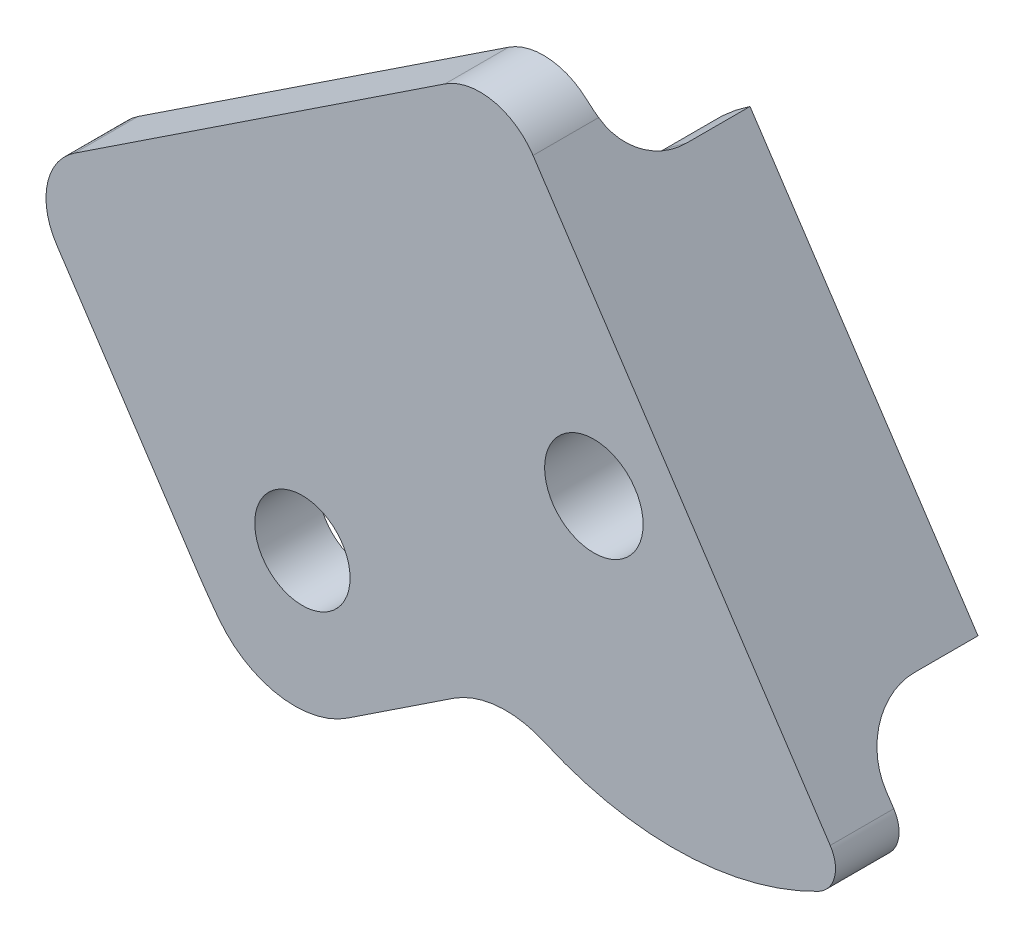
from build123d import *
from build123d.topology import SkipClean

# Parameters (mm, degrees)
EXTRUDE_1_DEPTH     = 2
EXTRUDE_START       = 4
SKETCH_3_R          = 1.55
EXTRUDE_2_DEPTH     = 4
FILLET_1_R          = 2
CUT_EXTRUDE_1_DEPTH = 10
FILLET_2_R          = 2


with BuildPart() as part:
    # 草图2 → 凸台-拉伸1 (new body)
    with BuildSketch(Plane.XY):
        with BuildLine():
            Line((14.564994601, -11.669618141), (7.389813792, -0.829102454))
            Line((7.389813792, -0.829102454), (6.837876806, 0.004783368))
            Line((6.837876806, 0.004783368), (4.07819188, 4.174212479))
            Line((4.07819188, 4.174212479), (3.526254895, 5.008098301))
            Line((3.526254895, 5.008098301), (-3.648925914, 15.848613988))
            Line((-3.648925914, 15.848613988), (-4.2008629, 16.68249981))
            Line((-4.2008629, 16.68249981), (-4.998009984, 17.886857679))
            ThreePointArc((-4.998009984, 17.886857679), (-5.687361464, 18.324420478), (-6.473069172, 18.102316754))
            ThreePointArc((-6.473069172, 18.102316754), (-9.153711125, 14.591132343), (-10.06004351, 10.267613076))
            ThreePointArc((-10.06004351, 10.267613076), (-10.405656258, 8.820717267), (-11.403844954, 7.717732689))
            Line((-11.403844954, 7.717732689), (-14.736003804, 5.512224858))
            ThreePointArc((-14.736003804, 5.512224858), (-15.998358454, 3.706490878), (-15.686779581, 1.525405581))
            ThreePointArc((-15.686779581, 1.525405581), (-15.380816242, 1.008667124), (-15.057770631, 0.502432268))
            Line((-15.057770631, 0.502432268), (-4.019030925, -16.175284173))
            ThreePointArc((-4.019030925, -16.175284173), (-3.679263259, -16.670450943), (-3.323152402, -17.153997481))
            ThreePointArc((-3.323152402, -17.153997481), (-1.437196365, -18.293025266), (0.718231785, -17.83657816))
            Line((0.718231785, -17.83657816), (4.050390635, -15.631070329))
            ThreePointArc((4.050390635, -15.631070329), (5.455716688, -15.143203199), (6.922632961, -15.390412219))
            ThreePointArc((6.922632961, -15.390412219), (11.256585707, -16.245462422), (15.536058254, -15.149847541))
            ThreePointArc((15.536058254, -15.149847541), (16.047506269, -14.513382621), (15.91407867, -13.707861832))
            Line((15.91407867, -13.707861832), (15.116931586, -12.503503963))
            Line((15.116931586, -12.503503963), (14.564994601, -11.669618141))
        make_face()
        with BuildLine():
            ThreePointArc((-1.270469952, 9.628047515), (-3.418495303, 10.065068212), (-3.855516, 7.917042861))
            ThreePointArc((-3.855516, 7.917042861), (-1.707490649, 7.480022164), (-1.270469952, 9.628047515))
        make_face(mode=Mode.SUBTRACT)
        with BuildLine():
            ThreePointArc((7.183223706, -8.76067358), (9.331249057, -9.197694277), (9.768269754, -7.049668926))
            ThreePointArc((9.768269754, -7.049668926), (7.620244403, -6.612648229), (7.183223706, -8.76067358))
        make_face(mode=Mode.SUBTRACT)
        with BuildLine():
            ThreePointArc((-1.947826046, -14.804383569), (0.130908165, -15.227306825), (0.55383142, -13.148572614))
            ThreePointArc((0.55383142, -13.148572614), (-1.524902791, -12.725649358), (-1.947826046, -14.804383569))
        make_face(mode=Mode.SUBTRACT)
        with BuildLine():
            ThreePointArc((-10.484908286, 3.529143828), (-12.563642497, 3.952067083), (-12.986565752, 1.873332872))
            ThreePointArc((-12.986565752, 1.873332872), (-10.907831541, 1.450409617), (-10.484908286, 3.529143828))
        make_face(mode=Mode.SUBTRACT)
    extrude(amount=EXTRUDE_1_DEPTH)

    # 草图3 → 凸台-拉伸2 (add)
    # profile 1 of 2: a face of its own
    with SkipClean():  # the faces are left unmerged after this step: merging them gives an invalid solid
        with BuildSketch(Plane(origin=(0, 0, 0), x_dir=(-1, 0, 0), z_dir=(0, 0, -1)).offset(EXTRUDE_START)):
            with BuildLine():
                ThreePointArc((-3.526254895, 5.008098301), (5.481593353, 6.84076574), (3.648925914, 15.848613988))
                Line((3.648925914, 15.848613988), (-3.526254895, 5.008098301))
            make_face()
            with Locations((2.562992976, 8.772545188)):
                Circle(SKETCH_3_R, mode=Mode.SUBTRACT)
        # profile 2 of 2: a face of its own
        with BuildSketch(Plane(origin=(0, 0, 0), x_dir=(-1, 0, 0), z_dir=(0, 0, -1)).offset(EXTRUDE_START)):
            with BuildLine():
                ThreePointArc((-14.564994601, -11.669618141), (-5.557146353, -9.836950702), (-7.389813792, -0.829102454))
                Line((-7.389813792, -0.829102454), (-14.564994601, -11.669618141))
            make_face()
            with Locations((-8.47574673, -7.905171253)):
                Circle(SKETCH_3_R, mode=Mode.SUBTRACT)
        extrude(amount=-EXTRUDE_2_DEPTH)

    # 圆角1
    # the kernel refuses this fillet: 2 mm, written as the material it adds along each edge
    with BuildSketch(Plane(origin=(10.977404196, -6.249360297, 0), x_dir=(0.5519369853128372, -0.8338858220666526, 0), z_dir=(0.8338858220666526, 0.5519369853128372, 0))) as fillet_1_piece_1:
        with BuildLine():
            CenterArc((6.5 + FILLET_1_R, FILLET_1_R), FILLET_1_R, 180, 90)
            Line((6.5, FILLET_1_R), (6.5, 0))
            Line((6.5, 0), (6.5 + FILLET_1_R, 0))
        make_face()
    revolve(axis=Axis((10.977404196, -6.249360297, 0), (0, 0, -1)), revolution_arc=180)
    with BuildSketch(Plane(origin=(-0.06133551, 10.428356144, 0), x_dir=(0.5519369853122391, -0.8338858220670484, 0), z_dir=(0.8338858220670484, 0.5519369853122391, 0))) as fillet_1_piece_2:
        with BuildLine():
            CenterArc((6.5 + FILLET_1_R, FILLET_1_R), FILLET_1_R, 180, 90)
            Line((6.5, FILLET_1_R), (6.5, 0))
            Line((6.5, 0), (6.5 + FILLET_1_R, 0))
        make_face()
    revolve(axis=Axis((-0.06133551, 10.428356144, 0), (0, 0, -1)), revolution_arc=180)

    # 草图4 → 切除-拉伸1 (cut)
    with BuildSketch(Plane.XY.offset(2)):
        Polygon((5.458034343, 2.089497924), (-9.538400778, -7.836425953), (-26.545257477, 2.73324315), (-0.393587014, 27.879080134), align=None)
    extrude(amount=-CUT_EXTRUDE_1_DEPTH, mode=Mode.SUBTRACT)

    # 圆角2
    # the kernel refuses this fillet: 2 mm, written as the material it takes off along each edge
    with BuildSketch(Plane(origin=(5.458034343, 2.089497924, 7), x_dir=(-0.8338858220669847, -0.5519369853123355, 0), z_dir=(0, 0, -1))) as fillet_2_piece_1:
        with BuildLine():
            CenterArc((FILLET_2_R, -FILLET_2_R), FILLET_2_R, 90, 90)
            Line((0, -FILLET_2_R), (0, 0))
            Line((0, 0), (FILLET_2_R, 0))
        make_face()
    extrude(amount=12, mode=Mode.SUBTRACT)
    with BuildSketch(Plane(origin=(-9.538400778, -7.836425953, 7), x_dir=(0.8338858220669851, 0.5519369853123349, 0), z_dir=(0, 0, -1))) as fillet_2_piece_2:
        with BuildLine():
            CenterArc((FILLET_2_R, FILLET_2_R), FILLET_2_R, 180, 90)
            Line((0, FILLET_2_R), (0, 0))
            Line((0, 0), (FILLET_2_R, 0))
        make_face()
    extrude(amount=12, mode=Mode.SUBTRACT)


solid = part.part
